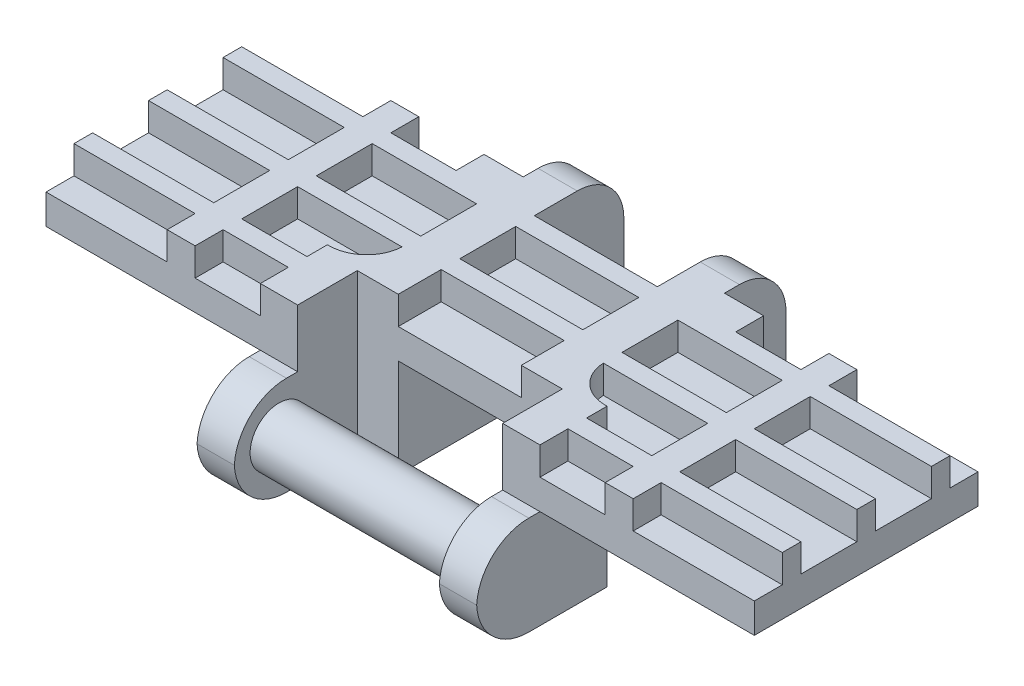
from build123d import *

# Parameters (mm, degrees)
SKETCH_1_W               = 38
SKETCH_1_H               = 12
EXTRUDE_1_DEPTH          = 1.6
EXTRUDE_START            = 1.6
SKETCH_1_3_W             = 38
SKETCH_1_3_H             = 1
SKETCH_1_3_W_2           = 1.5
SKETCH_1_3_H_2           = 12
EXTRUDE_2_DEPTH          = 1.5
EXTRUDE_START_2          = 3.1
EXTRUDE_3_DEPTH          = 8.4
SKETCH_2_4_W             = 2.1
SKETCH_2_4_H             = 1.5
EXTRUDE_5_DEPTH          = 3.1
CUT_EXTRUDE_1_DEPTH      = 22.850629282
FILLET_1_R               = 3
EXTRUDE_4_REACH          = 28.771
SKETCH_3_R               = 1.55
CUT_EXTRUDE_2_DEPTH      = 27.771253239
CUT_EXTRUDE_2_DEPTH_BACK = 27.771253239
SKETCH_3_3_R             = 1.7
SKETCH_3_3_W             = 6.5
SKETCH_3_3_H             = 1.2
SKETCH_3_3_W_2           = 3.4
SKETCH_3_3_H_2           = 3.1
FILLET_2_R               = 2.8
FILLET_3_R               = 2.5
FILLET_4_R               = 1
FILLET_5_R               = 0.3
FILLET_6_R               = 2


with BuildPart() as part:
    # 草图1 → 凸台-拉伸1 (new body)
    with BuildSketch(Plane(origin=(0, 0, 0), x_dir=(1, 0, 0), z_dir=(0, 1, 0))):
        Rectangle(SKETCH_1_W, SKETCH_1_H)
    extrude(amount=EXTRUDE_1_DEPTH)

    # 草图1<3> → 凸台-拉伸2 (add)
    with BuildSketch(Plane(origin=(0, 0, 0), x_dir=(1, 0, 0), z_dir=(0, 1, 0)).offset(EXTRUDE_START)):
        with Locations((0, 4)):
            Rectangle(SKETCH_1_3_W, SKETCH_1_3_H)
        Rectangle(SKETCH_1_3_W, SKETCH_1_3_H)
        with Locations((0, -4)):
            Rectangle(SKETCH_1_3_W, SKETCH_1_3_H)
        with Locations((-11.75, 0)):
            Rectangle(SKETCH_1_3_W_2, SKETCH_1_3_H_2)
        with Locations((11.75, 0)):
            Rectangle(SKETCH_1_3_W_2, SKETCH_1_3_H_2)
    extrude(amount=EXTRUDE_2_DEPTH)

    # 草图2 → 凸台-拉伸3 (add)
    with BuildSketch(Plane(origin=(0, 0, 0), x_dir=(1, 0, 0), z_dir=(0, 1, 0)).offset(EXTRUDE_START_2)):
        Polygon((-3.3, 9.3), (-5.4, 9.3), (-5.4, -2.4), (-7.5, -2.4), (-7.5, -9.4), (-5.5, -9.4), (-5.5, -2.8), (-3.3, -2.8), align=None)
        Polygon((5.4, 9.3), (3.3, 9.3), (3.3, -2.8), (5.5, -2.8), (5.5, -9.4), (7.5, -9.4), (7.5, -2.4), (5.4, -2.4), align=None)
    extrude(amount=-EXTRUDE_3_DEPTH)

    # 草图2<4> → 凸台-拉伸5 (add)
    with BuildSketch(Plane(origin=(0, 0, 0), x_dir=(1, 0, 0), z_dir=(0, 1, 0))):
        with Locations((-6.45, 5.25)):
            Rectangle(SKETCH_2_4_W, SKETCH_2_4_H)
        with Locations((6.45, 5.25)):
            Rectangle(SKETCH_2_4_W, SKETCH_2_4_H)
    extrude(amount=EXTRUDE_5_DEPTH)

    # 草图2<3> → 切除-拉伸1 (cut, through all)
    with BuildSketch(Plane(origin=(0, 0, 0), x_dir=(1, 0, 0), z_dir=(0, 1, 0))):
        Polygon((0, -9.4), (0, -2.8), (-3.3, -2.8), (-5.4, -2.8), (-5.5, -2.8), (-5.5, -9.4), align=None)
        Polygon((3.3, -2.8), (0, -2.8), (0, -9.4), (5.5, -9.4), (5.5, -2.8), (5.4, -2.8), align=None)
    extrude(amount=CUT_EXTRUDE_1_DEPTH, mode=Mode.SUBTRACT)

    # 圆角1
    # the kernel refuses this fillet: 3 mm, written as the material it adds along each edge
    with BuildSketch(Plane(origin=(5.4, 7.154544011, 2.4), x_dir=(1, 0, 0), z_dir=(0, -1, 0))) as fillet_1_piece_1_section:
        with BuildLine():
            CenterArc((3, -2.861817604), FILLET_1_R, 107.457603124, 72.542396876)
            Line((0, -2.861817604), (0, 0))
            Line((0, 0), (2.1, 0))
        make_face()
    fillet_1_piece_1 = extrude(amount=12.454544011, mode=Mode.PRIVATE)
    fillet_1_piece_1 = split(fillet_1_piece_1, bisect_by=Plane(origin=(6.297598678, 1.6, 1.686657362), z_dir=(0, -1, 0)), keep=Keep.TOP, mode=Mode.PRIVATE)
    add(fillet_1_piece_1)
    with BuildSketch(Plane(origin=(-5.4, 0, 2.4), x_dir=(0, 0, -1), z_dir=(0, -1, 0))) as fillet_1_piece_2:
        with BuildLine():
            CenterArc((2.861817604, -3), FILLET_1_R, 90, 72.542396876)
            Line((0, -2.1), (0, 0))
            Line((0, 0), (2.861817604, 0))
        make_face()
    extrude(amount=5.3)

    # 草图3 → 凸台-拉伸4 (add, up to next)
    with BuildSketch(Plane(origin=(-5.5, 0, 0), x_dir=(0, 0, -1), z_dir=(1, 0, 0)), mode=Mode.PRIVATE) as extrude_4_sk1:
        with Locations((-7, -2.5)):
            Circle(SKETCH_3_R)
    extrude_4_tool1 = extrude(extrude_4_sk1.sketch, amount=EXTRUDE_4_REACH, mode=Mode.PRIVATE) - part.part
    add(extrude_4_tool1.solids().sort_by_distance((-5.5, -2.5, 7))[0])

    # 草图3<3> → 切除-拉伸2 (cut, two sides: drawn at the far end of the back side and taken through both)
    with BuildSketch(Plane(origin=(-5.5, 0, 0), x_dir=(0, 0, -1), z_dir=(1, 0, 0)).offset(-CUT_EXTRUDE_2_DEPTH_BACK)):
        with Locations((5.58, -2.5)):
            Circle(SKETCH_3_3_R)
        with Locations((6.05, -4.7)):
            Rectangle(SKETCH_3_3_W, SKETCH_3_3_H)
        with Locations((-7.7, 1.55)):
            Rectangle(SKETCH_3_3_W_2, SKETCH_3_3_H_2)
    extrude(amount=CUT_EXTRUDE_2_DEPTH + CUT_EXTRUDE_2_DEPTH_BACK, mode=Mode.SUBTRACT)

    # 圆角2
    # the kernel refuses this fillet: 2.8 mm, written as the material it takes off along each edge
    with BuildSketch(Plane(origin=(-1.5, 0, 9.4), x_dir=(0, 0, -1), z_dir=(1, 0, 0)), Plane(origin=(-14.5, 0, 9.4), x_dir=(0, 0, -1), z_dir=(1, 0, 0))) as fillet_2_piece_1:
        with BuildLine():
            CenterArc((FILLET_2_R, -FILLET_2_R), FILLET_2_R, 90, 90)
            Line((0, -FILLET_2_R), (0, 0))
            Line((0, 0), (FILLET_2_R, 0))
        make_face()
    extrude(amount=16, mode=Mode.SUBTRACT)
    with BuildSketch(Plane(origin=(-1.5, -5.3, 9.4), x_dir=(0, 0, -1), z_dir=(1, 0, 0)), Plane(origin=(-14.5, -5.3, 9.4), x_dir=(0, 0, -1), z_dir=(1, 0, 0))) as fillet_2_piece_2:
        with BuildLine():
            CenterArc((FILLET_2_R, FILLET_2_R), FILLET_2_R, 180, 90)
            Line((0, FILLET_2_R), (0, 0))
            Line((0, 0), (FILLET_2_R, 0))
        make_face()
    extrude(amount=16, mode=Mode.SUBTRACT)

    # 圆角3
    fillet_3_edges = [part.edges().sort_by_distance(p)[0] for p in [
        (-4.35, 3.1, -9.3),
        (4.35, 3.1, -9.3),
    ]]
    fillet(fillet_3_edges, radius=FILLET_3_R)

    # 圆角4
    fillet_4_edges = [part.edges().sort_by_distance(p)[0] for p in [
        (-4.35, -4.1, -9.3),
        (4.35, -4.1, -9.3),
    ]]
    fillet(fillet_4_edges, radius=FILLET_4_R)

    # 圆角5
    fillet_5_edges = [part.edges().sort_by_distance(p)[0] for p in [
        (-4.35, -4.1, -5.005543735),
        (4.35, -4.1, -5.005543735),
        (-4.35, -4.1, -6.154456265),
        (4.35, -4.1, -6.154456265),
    ]]
    fillet(fillet_5_edges, radius=FILLET_5_R)

    # 圆角6
    # the kernel refuses this fillet: 2 mm, written as the material it adds along each edge
    with BuildSketch(Plane(origin=(5.4, 3.1, 2.4), x_dir=(0, 0, -1), z_dir=(0, -1, 0))) as fillet_6_piece_1:
        with BuildLine():
            CenterArc((2, 1.997498436), FILLET_6_R, 180, 87.134016017)
            Line((0, 1.997498436), (-0.04, 1.997498436))
            Line((-0.04, 1.997498436), (-0.04, 0))
            Line((-0.04, 0), (0, -0.04))
            ThreePointArc((0, -0.04), (0.95, -0.04), (1.898, -0.039949969))
            Line((1.898, -0.039949969), (1.9, 0))
        make_face()
    extrude(amount=6.493746089)
    with BuildSketch(Plane(origin=(-5.4, 3.1, 2.4), x_dir=(-1, 0, 0), z_dir=(0, -1, 0))) as fillet_6_piece_2:
        with BuildLine():
            CenterArc((1.997498436, 2), FILLET_6_R, 182.865983983, 87.134016017)
            Line((0, 1.9), (-0.039949969, 1.898))
            ThreePointArc((-0.039949969, 1.898), (-0.04, 0.95), (-0.04, 0))
            Line((-0.04, 0), (0, -0.04))
            Line((0, -0.04), (1.997498436, -0.04))
            Line((1.997498436, -0.04), (1.997498436, 0))
        make_face()
    extrude(amount=6.493746089)


solid = part.part
